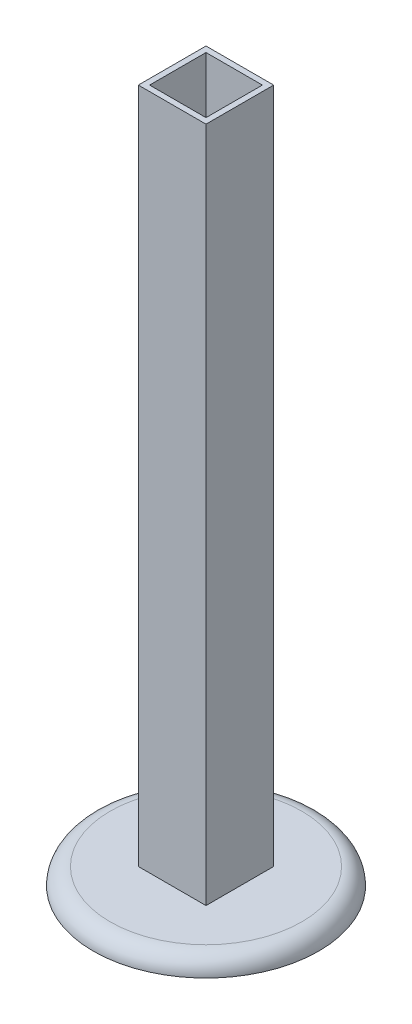
from build123d import *

# Parameters (mm, degrees)
SKETCH1_R           = 200
BOSS_EXTRUDE1_DEPTH = 30
FILLET1_R           = 30
SKETCH2_W           = 120
SKETCH2_H           = 120
BOSS_EXTRUDE2_DEPTH = 1200
SHELL1_T            = -10


with BuildPart() as part:
    # Sketch1 → Boss-Extrude1 (new body)
    with BuildSketch(Plane(origin=(0, 0, 0), x_dir=(1, 0, 0), z_dir=(0, 1, 0))):
        with Locations(Location((0, 0, 0), (0, 0, 270))):
            Circle(SKETCH1_R)
    extrude(amount=BOSS_EXTRUDE1_DEPTH)

    # Fillet1
    fillet1_edges = [part.edges().sort_by_distance(p)[0] for p in [
        (0, 30, -200),
    ]]
    fillet(fillet1_edges, radius=FILLET1_R - 0.0001)  # a hair under: the kernel refuses the full size

    # Sketch2 → Boss-Extrude2 (add)
    with BuildSketch(Plane(origin=(0, 30, 0), x_dir=(1, 0, 0), z_dir=(0, 1, 0))):
        Rectangle(SKETCH2_W, SKETCH2_H)
    extrude(amount=BOSS_EXTRUDE2_DEPTH)

    # Shell1
    shell1_openings = [part.faces().sort_by_distance(p)[0] for p in [
        (0, 1230, 0),
    ]]
    offset(amount=SHELL1_T, openings=shell1_openings, kind=Kind.INTERSECTION)


solid = part.part
